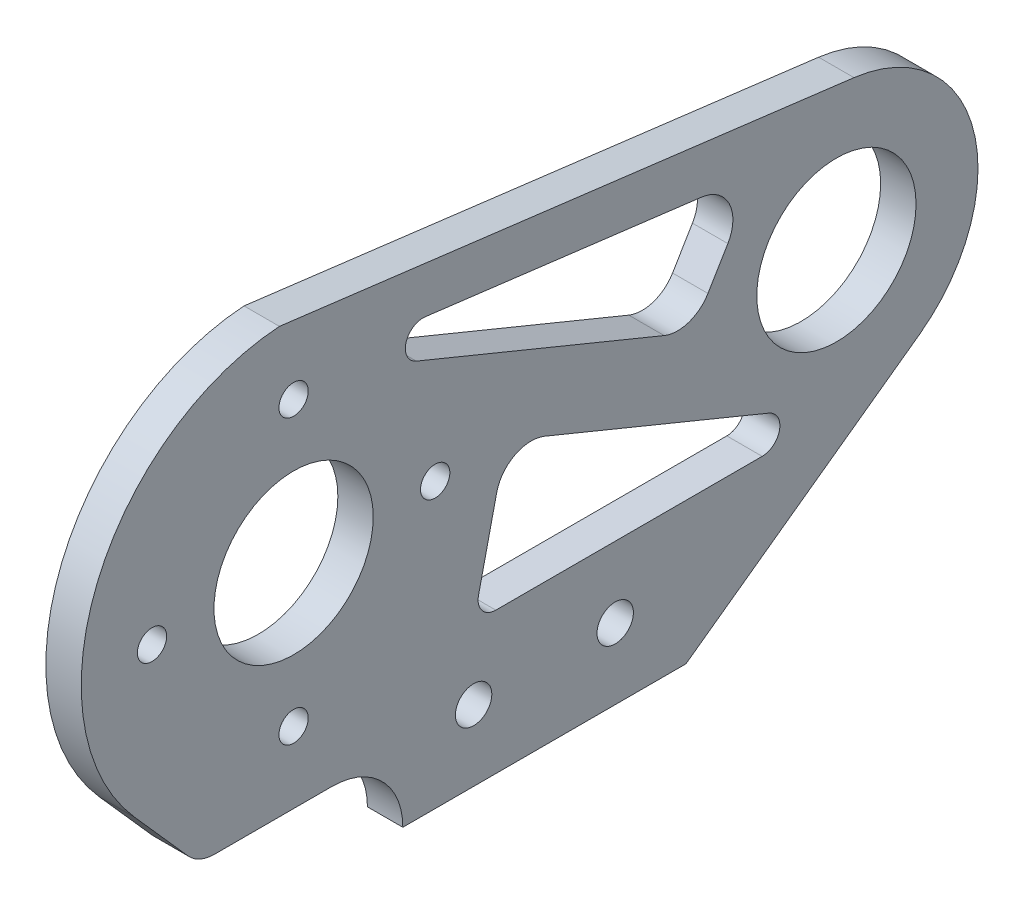
from build123d import *

# Parameters (mm, degrees)
SKETCH1_R           = 3.2639
SKETCH1_R_2         = 14.2875
SKETCH1_R_3         = 2.6289
BOSS_EXTRUDE1_DEPTH = 6.35
CUT_EXTRUDE1_DEPTH  = 6.35
CUT_EXTRUDE2_DEPTH  = 157.455309971
FILLET1_R           = 6.35
FILLET2_R           = 6.35
FILLET3_R           = 3.175
FILLET4_R           = 6.35
FILLET5_R           = 3.175
FILLET6_R           = 3.175
FILLET7_R           = 12.7
FILLET8_R           = 6.35


with BuildPart() as part:
    # Sketch1 → Boss-Extrude1 (new body)
    with BuildSketch(Plane(origin=(0, 0, 0), x_dir=(0, 0, -1), z_dir=(1, 0, 0))):
        with BuildLine():
            Line((0, 0), (76.2, 0))
            Line((76.2, 0), (118.05161028, 30.203441414))
            ThreePointArc((118.05161028, 30.203441414), (127.79577467, 57.092282399), (106.340627785, 76.003527237))
            Line((106.340627785, 76.003527237), (3.257374761, 88.899923295))
            ThreePointArc((3.257374761, 88.899923295), (-29.445545679, 65.344858986), (-22.705011853, 25.609644583))
            Line((-22.705011853, 25.609644583), (0, 0))
        make_face()
        with Locations((38.1, 12.7)):
            Circle(SKETCH1_R, mode=Mode.SUBTRACT)
        with Locations((63.5, 12.7)):
            Circle(SKETCH1_R, mode=Mode.SUBTRACT)
        with Locations((103.1875, 50.8)):
            Circle(SKETCH1_R_2, mode=Mode.SUBTRACT)
        with Locations((5.803937203, 50.885123286)):
            Circle(SKETCH1_R_2, mode=Mode.SUBTRACT)
        with Locations((5.803937203, 76.285123286)):
            Circle(SKETCH1_R_3, mode=Mode.SUBTRACT)
        with Locations((5.803937203, 25.485123286)):
            Circle(SKETCH1_R_3, mode=Mode.SUBTRACT)
        with Locations((31.203937203, 50.885123286)):
            Circle(SKETCH1_R_3, mode=Mode.SUBTRACT)
        with Locations((-19.596062797, 50.885123286)):
            Circle(SKETCH1_R_3, mode=Mode.SUBTRACT)
    extrude(amount=BOSS_EXTRUDE1_DEPTH)

    # Sketch2 → Cut-Extrude1 (cut)
    with BuildSketch(Plane.ZY):
        Polygon((0, 0), (-25.4, 0), (-25.4, 12.7), (0, 12.7), (11.95076388, 12.7), (11.95076388, 0), align=None)
    extrude(amount=-CUT_EXTRUDE1_DEPTH, mode=Mode.SUBTRACT)

    # Sketch3 → Cut-Extrude2 (cut, through all)
    with BuildSketch(Plane.ZY):
        Polygon((-105.957463546, 25.4), (-43.903937203, 50.885123286), (-38.1, 25.4), align=None)
        Polygon((-88.713516137, 69.889443956), (-77.333414898, 50.885123286), (-5.803937203, 80.261980092), align=None)
    extrude(amount=-CUT_EXTRUDE2_DEPTH, mode=Mode.SUBTRACT)

    # Fillet1
    fillet1_edges = [part.edges().sort_by_distance(p)[0] for p in [
        (3.175, 50.885123286, -77.333414898),
    ]]
    fillet(fillet1_edges, radius=FILLET1_R)

    # Fillet2
    fillet2_edges = [part.edges().sort_by_distance(p)[0] for p in [
        (3.175, 69.889443956, -88.713516137),
    ]]
    fillet(fillet2_edges, radius=FILLET2_R)

    # Fillet3
    fillet3_edges = [part.edges().sort_by_distance(p)[0] for p in [
        (3.175, 80.261980092, -5.803937203),
    ]]
    fillet(fillet3_edges, radius=FILLET3_R)

    # Fillet4
    fillet4_edges = [part.edges().sort_by_distance(p)[0] for p in [
        (3.175, 50.885123286, -43.903937203),
    ]]
    fillet(fillet4_edges, radius=FILLET4_R)

    # Fillet5
    fillet5_edges = [part.edges().sort_by_distance(p)[0] for p in [
        (3.175, 25.4, -38.1),
    ]]
    fillet(fillet5_edges, radius=FILLET5_R)

    # Fillet6
    fillet6_edges = [part.edges().sort_by_distance(p)[0] for p in [
        (3.175, 25.4, -105.957463546),
    ]]
    fillet(fillet6_edges, radius=FILLET6_R)

    # Fillet7
    fillet7_edges = [part.edges().sort_by_distance(p)[0] for p in [
        (3.175, 12.7, -25.4),
    ]]
    fillet(fillet7_edges, radius=FILLET7_R - 0.0001)  # a hair under: the kernel refuses the full size

    # Fillet8
    fillet8_edges = [part.edges().sort_by_distance(p)[0] for p in [
        (3.175, 12.7, 11.259572526),
    ]]
    fillet(fillet8_edges, radius=FILLET8_R)


solid = part.part
